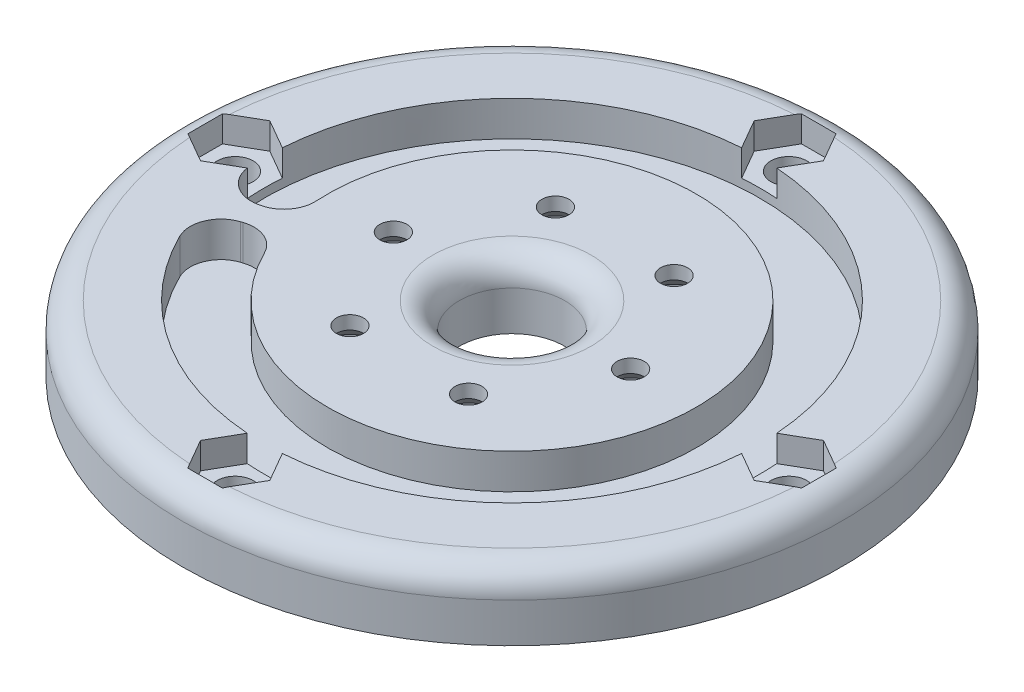
from build123d import *

# Parameters (mm, degrees)
SKETCH_1_R               = 37.5
EXTRUDE_1_DEPTH          = 7.5
SKETCH_2_R               = 2.05
CUT_EXTRUDE_1_DEPTH      = 54.560713214
CUT_EXTRUDE_2_DEPTH      = 3
PATTERN_CIRCULAR_1_COUNT = 4
SKETCH_4_R               = 3.05
CUT_EXTRUDE_3_DEPTH      = 4.5
PATTERN_CIRCULAR_2_COUNT = 6
SKETCH_7_R               = 28.2
SKETCH_7_R_2             = 21
CUT_EXTRUDE_4_DEPTH      = 4
SKETCH_9_R               = 6
CUT_EXTRUDE_5_DEPTH      = 54.560713214
EXTRUDE_3_DEPTH          = 4
FILLET_1_R               = 3
FILLET_3_R               = 3
FILLET_5_R               = 3.5
FILLET_6_R               = 3.5


with BuildPart() as part:
    # 草图1 → 凸台-拉伸1 (new body)
    with BuildSketch(Plane(origin=(0, 0, 0), x_dir=(1, 0, 0), z_dir=(0, 1, 0))):
        with Locations(Location((0, 0, 0), (0, 0, 270))):
            Circle(SKETCH_1_R)
    extrude(amount=EXTRUDE_1_DEPTH)

    # 草图2 → 切除-拉伸1 (cut, through all)
    with BuildSketch(Plane(origin=(0, 7.5, 0), x_dir=(1, 0, 0), z_dir=(0, 1, 0))):
        with Locations(Location((-31.5, 0, 0), (0, 0, 270))):
            Circle(SKETCH_2_R)
    cut_extrude_1 = extrude(amount=-CUT_EXTRUDE_1_DEPTH, mode=Mode.SUBTRACT)

    # 草图3 → 切除-拉伸2 (cut)
    with BuildSketch(Plane(origin=(0, 7.5, 0), x_dir=(1, 0, 0), z_dir=(0, 1, 0))):
        Polygon((-31.5, 3.944), (-34.915604193, 1.972), (-34.915604193, -1.972), (-31.5, -3.944), (-28.084395807, -1.972), (-28.084395807, 1.972), align=None)
    cut_extrude_2 = extrude(amount=-CUT_EXTRUDE_2_DEPTH, mode=Mode.SUBTRACT)

    # 阵列(圆周)1: 切除-拉伸1, 切除-拉伸2 ×4 about axis
    pattern_circular_1_axis = Axis((0, 0, 0), (0, 1, 0))
    add([cut_extrude_1.rotate(pattern_circular_1_axis, i * 360 / PATTERN_CIRCULAR_1_COUNT) for i in range(1, PATTERN_CIRCULAR_1_COUNT)], mode=Mode.SUBTRACT)
    add([cut_extrude_2.rotate(pattern_circular_1_axis, i * 360 / PATTERN_CIRCULAR_1_COUNT) for i in range(1, PATTERN_CIRCULAR_1_COUNT)], mode=Mode.SUBTRACT)

    # 草图4 → 切除-拉伸3 (cut)
    with BuildSketch(Plane.XZ):
        with Locations(Location((-13.5, 0, 0), (0, 0, 270))):
            Circle(SKETCH_4_R)
    cut_extrude_3 = extrude(amount=-CUT_EXTRUDE_3_DEPTH, mode=Mode.SUBTRACT)

    # 草图6 → CSK for M3 Countersunk Flat Head Screw1 (revolve, cut)
    with BuildSketch(Plane(origin=(-13.5, 4.5, 0), x_dir=(0, 0, -1), z_dir=(1, 0, 0))):
        Polygon((0, 0), (0, 3), (1.54, 3), (1.54, 1.48), (3.02, 0), align=None)
    csk_for_m3_countersunk_flat_head_screw1 = revolve(axis=Axis((-13.5, -1.85, 0), (0, 1, 0)), mode=Mode.SUBTRACT)

    # 阵列(圆周)2: 切除-拉伸3, CSK for M3 Countersunk Flat Head Screw1 ×6 about axis
    pattern_circular_2_axis = Axis((0, 0, 0), (0, 1, 0))
    add([cut_extrude_3.rotate(pattern_circular_2_axis, i * 360 / PATTERN_CIRCULAR_2_COUNT) for i in range(1, PATTERN_CIRCULAR_2_COUNT)], mode=Mode.SUBTRACT)
    add([csk_for_m3_countersunk_flat_head_screw1.rotate(pattern_circular_2_axis, i * 360 / PATTERN_CIRCULAR_2_COUNT) for i in range(1, PATTERN_CIRCULAR_2_COUNT)], mode=Mode.SUBTRACT)

    # 草图7 → 切除-拉伸4 (cut)
    with BuildSketch(Plane(origin=(0, 7.5, 0), x_dir=(1, 0, 0), z_dir=(0, 1, 0))):
        with Locations(Location((0, 0, 0), (0, 0, 270))):
            Circle(SKETCH_7_R)
        with Locations(Location((0, 0, 0), (0, 0, 270))):
            Circle(SKETCH_7_R_2, mode=Mode.SUBTRACT)
    extrude(amount=-CUT_EXTRUDE_4_DEPTH, mode=Mode.SUBTRACT)

    # 草图9 → 切除-拉伸5 (cut, through all)
    with BuildSketch(Plane(origin=(0, 7.5, 0), x_dir=(1, 0, 0), z_dir=(0, 1, 0))):
        with Locations(Location((0, 0, 0), (0, 0, 270))):
            Circle(SKETCH_9_R)
    extrude(amount=-CUT_EXTRUDE_5_DEPTH, mode=Mode.SUBTRACT)

    # 草图11 → 凸台-拉伸3 (add)
    with BuildSketch(Plane(origin=(0, 3.5, 0), x_dir=(1, 0, 0), z_dir=(0, 1, 0))):
        Polygon((-35.608419575, -11.759696227), (-36.717644054, -7.620014114), (-20.56188067, -4.267207904), (-19.940714962, -6.585429887), align=None)
    extrude(amount=EXTRUDE_3_DEPTH)

    # 圆角1
    # the kernel refuses this fillet: 3 mm, written as the material it takes off along each edge
    with BuildSketch(Plane(origin=(0, 7.5, 0), x_dir=(-0.9495578553408984, 0, 0.31359189938579934), z_dir=(-0.31359189938579934, 0, -0.9495578553408984))) as fillet_1_piece_1:
        with BuildLine():
            CenterArc((37.5 - FILLET_1_R, -FILLET_1_R), FILLET_1_R, 0, 90)
            Line((37.5 - FILLET_1_R, 0), (37.5, 0))
            Line((37.5, 0), (37.5, -FILLET_1_R))
        make_face()
    revolve(axis=Axis((0, 7.5, 0), (0, 1, 0)), revolution_arc=71.72417104, mode=Mode.SUBTRACT)
    with BuildSketch(Plane(origin=(0, 7.5, 0), x_dir=(-0.9791371747811866, 0, 0.20320037638133454), z_dir=(-0.20320037638133454, 0, -0.9791371747811866))) as fillet_1_piece_2:
        with BuildLine():
            CenterArc((37.5 - FILLET_1_R, -FILLET_1_R), FILLET_1_R, 0, 90)
            Line((37.5 - FILLET_1_R, 0), (37.5, 0))
            Line((37.5, 0), (37.5, -FILLET_1_R))
        make_face()
    revolve(axis=Axis((0, 7.5, 0), (0, 1, 0)), revolution_arc=6.55165792, mode=Mode.SUBTRACT)
    with BuildSketch(Plane(origin=(0, 7.5, 0), x_dir=(0, 0, 1), z_dir=(-1, 0, 0))) as fillet_1_piece_3:
        with BuildLine():
            CenterArc((37.5 - FILLET_1_R, -FILLET_1_R), FILLET_1_R, 0, 90)
            Line((37.5 - FILLET_1_R, 0), (37.5, 0))
            Line((37.5, 0), (37.5, -FILLET_1_R))
        make_face()
    revolve(axis=Axis((0, 7.5, 0), (0, 1, 0)), revolution_arc=281.72417104, mode=Mode.SUBTRACT)

    # 圆角3
    fillet_3_edges = [part.edges().sort_by_distance(p)[0] for p in [
        (0, 7.5, -6),
    ]]
    fillet(fillet_3_edges, radius=FILLET_3_R)

    # 圆角5
    fillet_5_edges = [part.edges().sort_by_distance(p)[0] for p in [
        (-26.777531521, 5.5, 8.843291563),
        (-27.611668329, 5.5, 5.730250614),
    ]]
    fillet(fillet_5_edges, radius=FILLET_5_R)

    # 圆角6
    fillet_6_edges = [part.edges().sort_by_distance(p)[0] for p in [
        (-20.56188067, 5.5, 4.267207904),
        (-19.940714962, 5.5, 6.585429887),
    ]]
    fillet(fillet_6_edges, radius=FILLET_6_R)


solid = part.part
